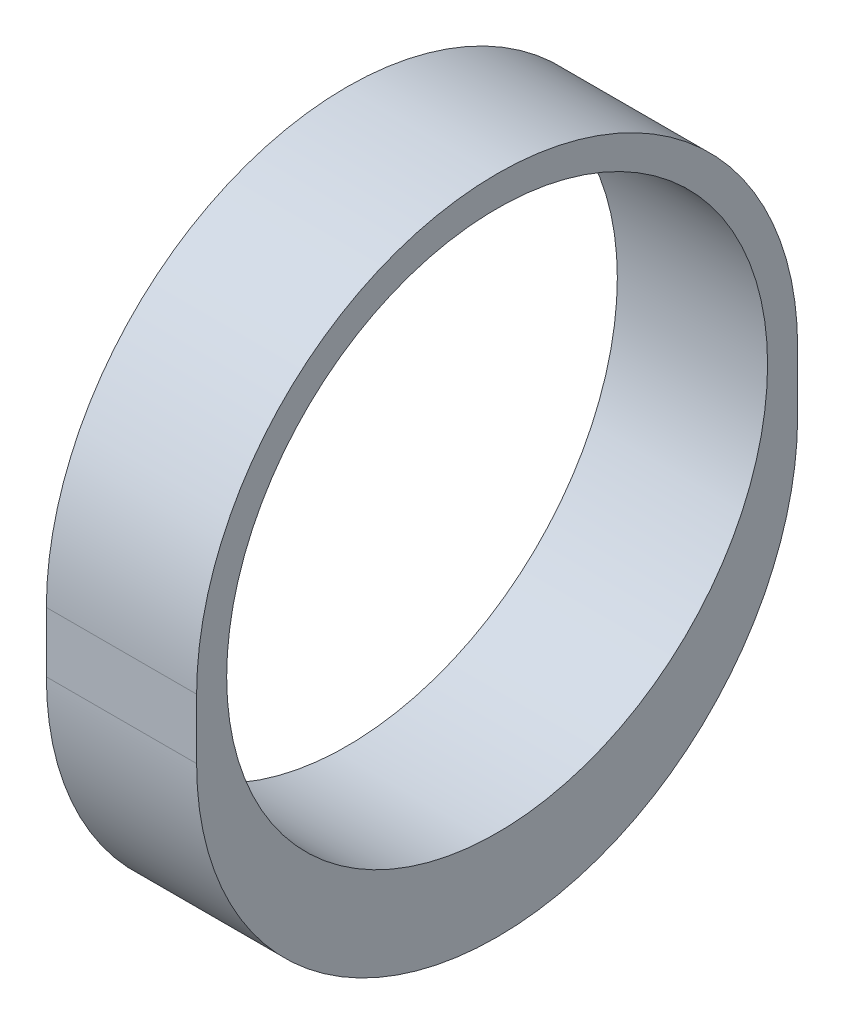
from build123d import *

# Parameters (mm, degrees)
SCHIZZO1_R                   = 9
ESTRUSIONE_ESTRUSIONE1_DEPTH = 2.5


with BuildPart() as part:
    # Schizzo1 → Estrusione-Estrusione1 (new, symmetric)
    with BuildSketch(Plane(origin=(0, 0, 0), x_dir=(0, 0, -1), z_dir=(1, 0, 0))):
        with BuildLine():
            Line((-10, 0), (-10, -2))
            ThreePointArc((-10, -2), (0, -12), (10, -2))
            Line((10, -2), (10, 0))
            ThreePointArc((10, 0), (0, 10), (-10, 0))
        make_face()
        Circle(SCHIZZO1_R, mode=Mode.SUBTRACT)
    extrude(amount=ESTRUSIONE_ESTRUSIONE1_DEPTH, both=True)


solid = part.part
